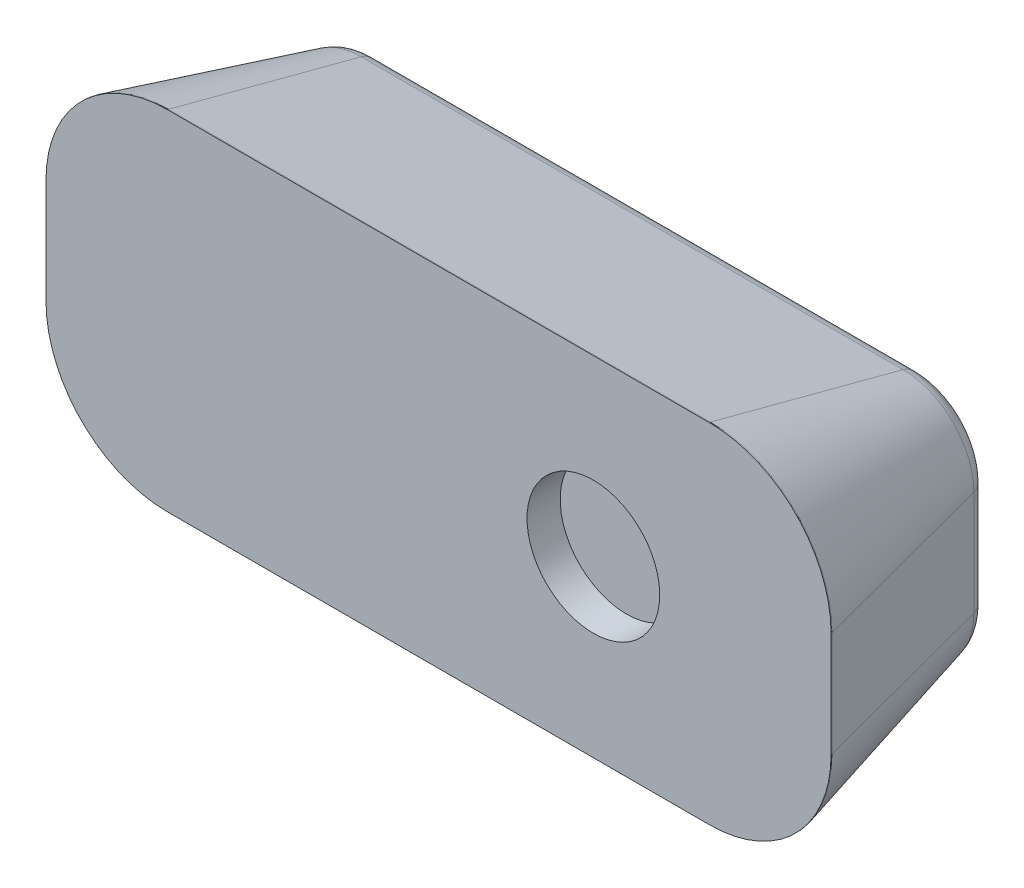
from build123d import *

# Parameters (mm, degrees)
SKETCH1_W           = 71
SKETCH1_H           = 31.5
BOSS_EXTRUDE1_DEPTH = 9.5
FILLET1_R           = 11
CHAMFER1_SIZE       = 5
CHAMFER1_SIZE2      = 18.924240442
SKETCH2_W           = 5.5
SKETCH2_H           = 7
BOSS_EXTRUDE2_DEPTH = 7
FILLET2_R           = 3.5
SKETCH3_R           = 1.5
CUT_EXTRUDE1_DEPTH  = 7
FILLET3_R           = 2
SKETCH4_R           = 6
CUT_EXTRUDE2_DEPTH  = 3


with BuildPart() as part:
    # Sketch1 → Boss-Extrude1 (new, symmetric)
    with BuildSketch(Plane.XY):
        Rectangle(SKETCH1_W, SKETCH1_H)
    extrude(amount=BOSS_EXTRUDE1_DEPTH, both=True)

    # Fillet1
    fillet1_edges = [part.edges().sort_by_distance(p)[0] for p in [
        (-35.5, 15.75, 0),
        (35.5, 15.75, 0),
        (35.5, -15.75, 0),
        (-35.5, -15.75, 0),
    ]]
    fillet(fillet1_edges, radius=FILLET1_R)

    # Chamfer1
    chamfer1_edges = [part.edges().sort_by_distance(p)[0] for p in [
        (0, -15.75, -9.5),
        (-35.5, 0, -9.5),
        (0, 15.75, -9.5),
        (35.5, 0, -9.5),
        (32.278174593, 12.528174593, -9.5),
        (32.278174593, -12.528174593, -9.5),
        (-32.278174593, 12.528174593, -9.5),
        (-32.278174593, -12.528174593, -9.5),
    ]]
    chamfer1_side = [part.faces().sort_by_distance(p)[0] for p in [
        (0, 0, -9.5),
    ]]
    chamfer(chamfer1_edges, length=CHAMFER1_SIZE, length2=CHAMFER1_SIZE2, reference=chamfer1_side[0])

    # Sketch2 → Boss-Extrude2 (add)
    with BuildSketch(Plane(origin=(0, 0, 0), x_dir=(0, 0, -1), z_dir=(1, 0, 0))):
        with Locations((12.25, 0)):
            Rectangle(SKETCH2_W, SKETCH2_H)
    extrude(amount=BOSS_EXTRUDE2_DEPTH)

    # Fillet2
    fillet2_edges = [part.edges().sort_by_distance(p)[0] for p in [
        (3.5, -3.5, -15),
        (3.5, 3.5, -15),
    ]]
    fillet(fillet2_edges, radius=FILLET2_R - 0.0001)  # a hair under: the kernel refuses the full size

    # Sketch3 → Cut-Extrude1 (cut)
    with BuildSketch(Plane(origin=(7, 0, 0), x_dir=(0, 0, -1), z_dir=(1, 0, 0))):
        with Locations((11.5, 0)):
            Circle(SKETCH3_R)
    extrude(amount=-CUT_EXTRUDE1_DEPTH, mode=Mode.SUBTRACT)

    # Fillet3
    fillet3_edges = [part.edges().sort_by_distance(p)[0] for p in [
        (0, 10.75, -9.5),
        (-28.742640687, 8.992640687, -9.5),
        (28.742640687, 8.992640687, -9.5),
        (-30.5, 0, -9.5),
        (30.5, 0, -9.5),
        (-28.742640687, -8.992640687, -9.5),
        (28.742640687, -8.992640687, -9.5),
        (0, -10.75, -9.5),
    ]]
    fillet(fillet3_edges, radius=FILLET3_R)

    # Sketch4 → Cut-Extrude2 (cut)
    with BuildSketch(Plane.XY.offset(9.5)):
        with Locations((14, 0)):
            Circle(SKETCH4_R)
    extrude(amount=-CUT_EXTRUDE2_DEPTH, mode=Mode.SUBTRACT)


solid = part.part
